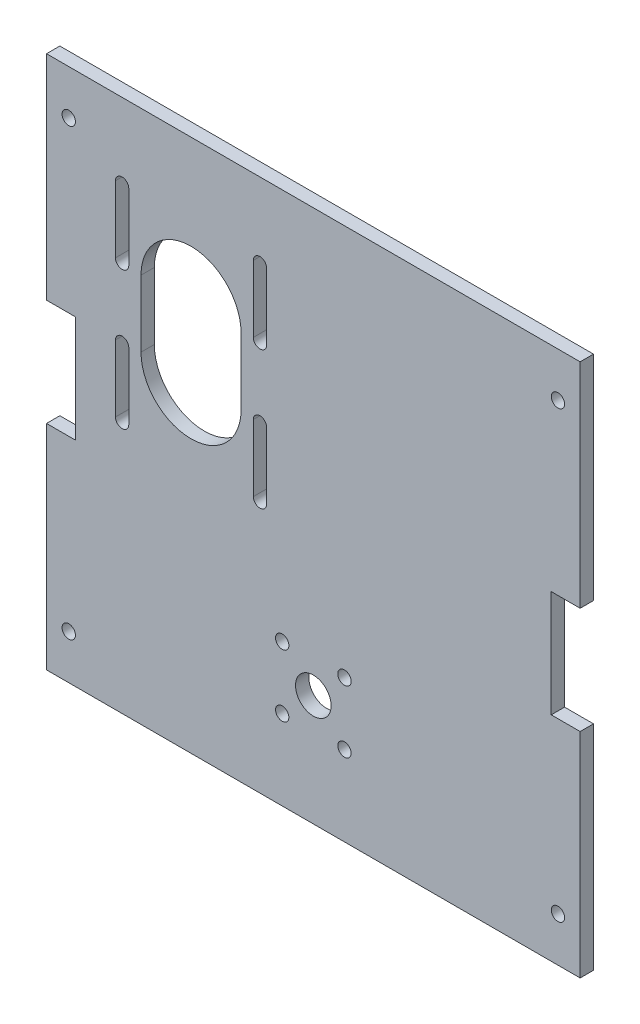
from build123d import *

# Parameters (mm, degrees)
ESQUISSE1_R             = 1.5
BOSS_EXTRU_1_DEPTH      = 3
ESQUISSE3_R             = 4
ESQUISSE3_R_2           = 1.5
ENL_V_MAT_EXTRU_3_DEPTH = 10


with BuildPart() as part:
    # Esquisse1 → Boss.-Extru.1 (new body)
    with BuildSketch(Plane.XY):
        Polygon((60, 65), (-60, 65), (-60, 17), (-53.5, 17), (-53.5, -7), (-60, -7), (-60, -25), (-60, -55), (-50, -55), (50, -55), (60, -55), (60, -25), (60, -7), (53.5, -7), (53.5, 17), (60, 17), align=None)
        with Locations((-55, -45)):
            Circle(ESQUISSE1_R, mode=Mode.SUBTRACT)
        with Locations((-55, 55)):
            Circle(ESQUISSE1_R, mode=Mode.SUBTRACT)
        with Locations((55, 55)):
            Circle(ESQUISSE1_R, mode=Mode.SUBTRACT)
        with Locations((55, -45)):
            Circle(ESQUISSE1_R, mode=Mode.SUBTRACT)
        with BuildLine():
            Line((-38.75, 17.5), (-38.75, 32.5))
            ThreePointArc((-38.75, 32.5), (-27.5, 43.75), (-16.25, 32.5))
            Line((-16.25, 32.5), (-16.25, 17.5))
            ThreePointArc((-16.25, 17.5), (-27.5, 6.25), (-38.75, 17.5))
        make_face(mode=Mode.SUBTRACT)
        with BuildLine():
            Line((-44.5, 33), (-44.5, 48))
            ThreePointArc((-44.5, 48), (-43, 49.5), (-41.5, 48))
            Line((-41.5, 48), (-41.5, 33))
            ThreePointArc((-41.5, 33), (-43, 31.5), (-44.5, 33))
        make_face(mode=Mode.SUBTRACT)
        with BuildLine():
            Line((-44.5, 2), (-44.5, 17))
            ThreePointArc((-44.5, 17), (-43, 18.5), (-41.5, 17))
            Line((-41.5, 17), (-41.5, 2))
            ThreePointArc((-41.5, 2), (-43, 0.5), (-44.5, 2))
        make_face(mode=Mode.SUBTRACT)
        with BuildLine():
            Line((-10.5, 2), (-10.5, 17))
            ThreePointArc((-10.5, 17), (-12, 18.5), (-13.5, 17))
            Line((-13.5, 17), (-13.5, 2))
            ThreePointArc((-13.5, 2), (-12, 0.5), (-10.5, 2))
        make_face(mode=Mode.SUBTRACT)
        with BuildLine():
            Line((-10.5, 33), (-10.5, 48))
            ThreePointArc((-10.5, 48), (-12, 49.5), (-13.5, 48))
            Line((-13.5, 48), (-13.5, 33))
            ThreePointArc((-13.5, 33), (-12, 31.5), (-10.5, 33))
        make_face(mode=Mode.SUBTRACT)
    extrude(amount=BOSS_EXTRU_1_DEPTH)

    # Esquisse3 → Enlèv. mat.-Extru.3 (cut)
    with BuildSketch(Plane.XY.offset(3)):
        with Locations((0, -30)):
            Circle(ESQUISSE3_R)
        with Locations((-7, -23)):
            Circle(ESQUISSE3_R_2)
        with Locations((7, -23)):
            Circle(ESQUISSE3_R_2)
        with Locations((7, -37)):
            Circle(ESQUISSE3_R_2)
        with Locations((-7, -37)):
            Circle(ESQUISSE3_R_2)
    extrude(amount=-ENL_V_MAT_EXTRU_3_DEPTH, mode=Mode.SUBTRACT)


solid = part.part
